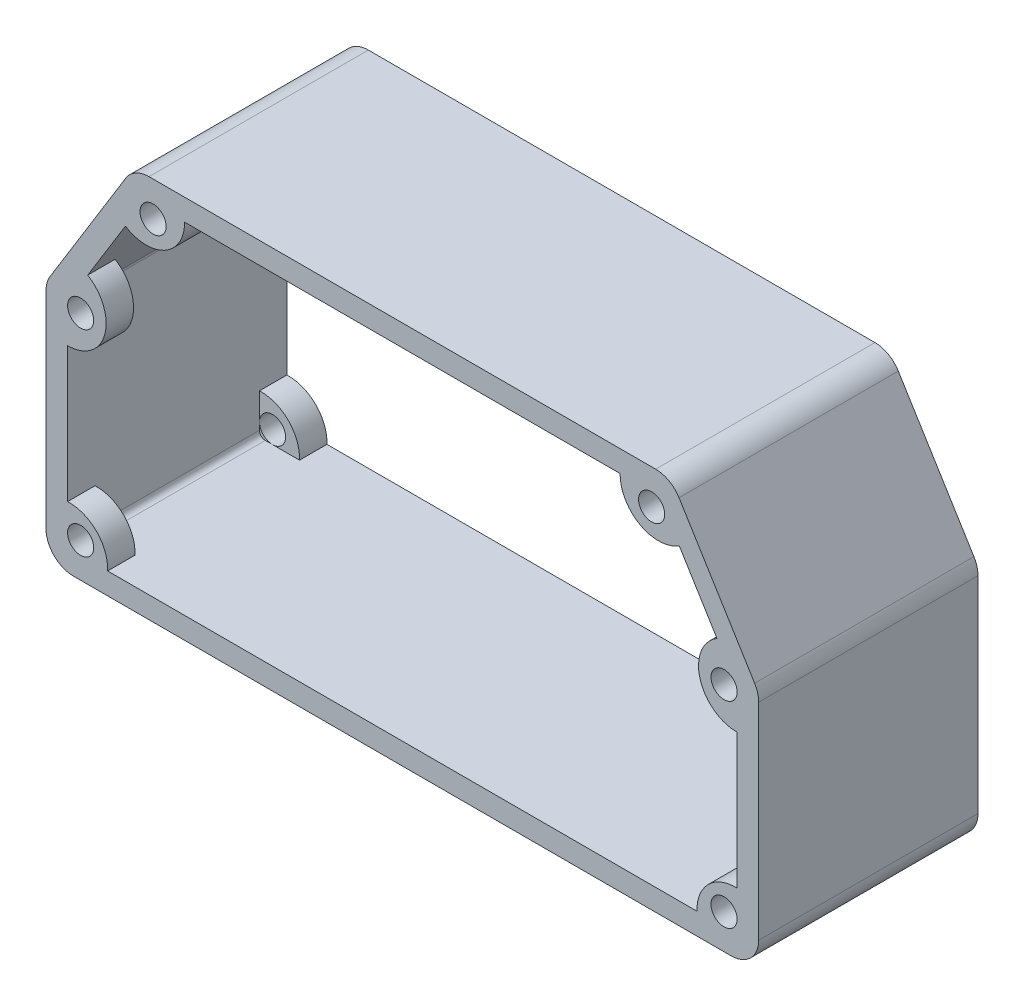
from build123d import *

# Parameters (mm, degrees)
SKETCH1_W               = 165.1
SKETCH1_H               = 88.9
BOSS_EXTRUDE1_DEPTH     = 50.8
CUT_EXTRUDE1_DEPTH      = 107.634633211
FILLET1_R               = 6.35
SHELL1_T                = -5
CUT_EXTRUDE2_DEPTH      = 105.345316138
BOSS_EXTRUDE2_DEPTH     = 6.35
CUT_EXTRUDE3_DEPTH      = 107.634633211
CUT_EXTRUDE3_DEPTH_BACK = 107.634633211
SKETCH6_R               = 3.025013
CUT_EXTRUDE4_DEPTH      = 1.27


with BuildPart() as part:
    # Sketch1 → Boss-Extrude1 (new body)
    with BuildSketch(Plane.XY):
        Rectangle(SKETCH1_W, SKETCH1_H)
    extrude(amount=BOSS_EXTRUDE1_DEPTH)

    # Sketch2 → Cut-Extrude1 (cut, through all)
    with BuildSketch(Plane(origin=(0, 0, 0), x_dir=(-1, 0, 0), z_dir=(0, 0, -1))):
        Polygon((-82.55, 44.45), (-82.55, 11.43), (-62.23, 44.45), align=None)
        Polygon((82.55, 44.45), (62.23, 44.45), (82.55, 11.43), align=None)
    extrude(amount=-CUT_EXTRUDE1_DEPTH, mode=Mode.SUBTRACT)

    # Fillet1
    fillet1_edges = [part.edges().sort_by_distance(p)[0] for p in [
        (82.55, -44.45, 25.4),
        (82.55, 11.43, 25.4),
        (62.23, 44.45, 25.4),
        (-62.23, 44.45, 25.4),
        (-82.55, 11.43, 25.4),
        (-82.55, -44.45, 25.4),
    ]]
    fillet(fillet1_edges, radius=FILLET1_R)

    # Shell1
    shell1_openings = [part.faces().sort_by_distance(p)[0] for p in [
        (0, -1.56423777, 0),
    ]]
    offset(amount=SHELL1_T, openings=shell1_openings, kind=Kind.INTERSECTION)

    # Sketch4 → Cut-Extrude2 (cut, through all)
    with BuildSketch(Plane(origin=(0, 0, 45.8), x_dir=(-1, 0, 0), z_dir=(0, 0, -1))):
        with BuildLine():
            Line((-59.831389245, 38.807531525), (-77.349738728, 10.340213616))
            ThreePointArc((-77.349738728, 10.340213616), (-77.498970223, 10.000345469), (-77.55, 9.632682092))
            Line((-77.55, 9.632682092), (-77.55, -38.1))
            ThreePointArc((-77.55, -38.1), (-77.154594155, -39.054594155), (-76.2, -39.45))
            Line((-76.2, -39.45), (76.2, -39.45))
            ThreePointArc((76.2, -39.45), (77.154594155, -39.054594155), (77.55, -38.1))
            Line((77.55, -38.1), (77.55, 9.632682092))
            ThreePointArc((77.55, 9.632682092), (77.498970223, 10.000345469), (77.349738728, 10.340213616))
            Line((77.349738728, 10.340213616), (59.831389245, 38.807531525))
            ThreePointArc((59.831389245, 38.807531525), (59.340183904, 39.278487921), (58.681650518, 39.45))
            Line((58.681650518, 39.45), (-58.681650518, 39.45))
            ThreePointArc((-58.681650518, 39.45), (-59.340183904, 39.278487921), (-59.831389245, 38.807531525))
        make_face()
    extrude(amount=-CUT_EXTRUDE2_DEPTH, mode=Mode.SUBTRACT)

    # Sketch5 → Boss-Extrude2 (add)
    with BuildSketch(Plane.XY.offset(50.8)):
        with BuildLine():
            Line((-76.2, -39.45), (-68.273391859, -39.45))
            ThreePointArc((-68.273391859, -39.45), (-70.86841487, -32.76841487), (-77.55, -30.173391859))
            Line((-77.55, -30.173391859), (-77.55, -38.1))
            ThreePointArc((-77.55, -38.1), (-77.154594155, -39.054594155), (-76.2, -39.45))
        make_face()
        with BuildLine():
            ThreePointArc((77.55, -30.173391859), (70.86841487, -32.76841487), (68.273391859, -39.45))
            Line((68.273391859, -39.45), (76.2, -39.45))
            ThreePointArc((76.2, -39.45), (77.154594155, -39.054594155), (77.55, -38.1))
            Line((77.55, -38.1), (77.55, -30.173391859))
        make_face()
        with BuildLine():
            Line((-77.55, 9.632682092), (-77.55, 1.110491929))
            ThreePointArc((-77.55, 1.110491929), (-68.945010753, 7.579214044), (-72.883280802, 17.598207745))
            Line((-72.883280802, 17.598207745), (-77.349738728, 10.340213616))
            ThreePointArc((-77.349738728, 10.340213616), (-77.498970223, 10.000345469), (-77.55, 9.632682092))
        make_face()
        with BuildLine():
            ThreePointArc((72.883280802, 17.598207745), (68.945010753, 7.579214044), (77.55, 1.110491929))
            Line((77.55, 1.110491929), (77.55, 9.632682092))
            ThreePointArc((77.55, 9.632682092), (77.498970223, 10.000345469), (77.349738728, 10.340213616))
            Line((77.349738728, 10.340213616), (72.883280802, 17.598207745))
        make_face()
        with BuildLine():
            Line((-59.831389245, 38.807531525), (-64.144612525, 31.798543695))
            ThreePointArc((-64.144612525, 31.798543695), (-55.003619605, 31.517926725), (-50.451838523, 39.45))
            Line((-50.451838523, 39.45), (-58.681650518, 39.45))
            ThreePointArc((-58.681650518, 39.45), (-59.340183904, 39.278487921), (-59.831389245, 38.807531525))
        make_face()
        with BuildLine():
            ThreePointArc((50.451838523, 39.45), (55.003619605, 31.517926725), (64.144612525, 31.798543695))
            Line((64.144612525, 31.798543695), (59.831389245, 38.807531525))
            ThreePointArc((59.831389245, 38.807531525), (59.340183904, 39.278487921), (58.681650518, 39.45))
            Line((58.681650518, 39.45), (50.451838523, 39.45))
        make_face()
    boss_extrude2 = extrude(amount=-BOSS_EXTRUDE2_DEPTH)

    # Mirror1: Boss-Extrude2 across plane
    add(boss_extrude2.mirror(Plane.XY.offset(25.4)))

    # Sketch6 → Cut-Extrude3 (cut, two sides: drawn at the far end of the back side and taken through both)
    with BuildSketch(Plane(origin=(0, 0, 0), x_dir=(-1, 0, 0), z_dir=(0, 0, -1)).offset(-CUT_EXTRUDE3_DEPTH_BACK)):
        with Locations((74.524987, -36.424987)):
            Circle(SKETCH6_R)
        with Locations((74.524987, 9.158582743)):
            Circle(SKETCH6_R)
        with Locations((57.745661304, 36.424987)):
            Circle(SKETCH6_R)
        with Locations((-57.745661304, 36.424987)):
            Circle(SKETCH6_R)
        with Locations((-74.524987, 9.158582743)):
            Circle(SKETCH6_R)
        with Locations((-74.524987, -36.424987)):
            Circle(SKETCH6_R)
    extrude(amount=CUT_EXTRUDE3_DEPTH + CUT_EXTRUDE3_DEPTH_BACK, mode=Mode.SUBTRACT)

    # Sketch7 → Cut-Extrude4 (cut)
    with BuildSketch(Plane.XY):
        with BuildLine():
            Line((-76.2, -43.18), (76.2, -43.18))
            ThreePointArc((76.2, -43.18), (79.792102448, -41.692102448), (81.28, -38.1))
            Line((81.28, -38.1), (81.28, 9.632682092))
            ThreePointArc((81.28, 9.632682092), (81.08797684, 11.016185763), (80.526424249, 12.295097014))
            Line((80.526424249, 12.295097014), (63.008074767, 40.762414922))
            ThreePointArc((63.008074767, 40.762414922), (61.15968726, 42.534606398), (58.681650518, 43.18))
            Line((58.681650518, 43.18), (-58.681650518, 43.18))
            ThreePointArc((-58.681650518, 43.18), (-61.15968726, 42.534606398), (-63.008074767, 40.762414922))
            Line((-63.008074767, 40.762414922), (-80.526424249, 12.295097014))
            ThreePointArc((-80.526424249, 12.295097014), (-81.08797684, 11.016185763), (-81.28, 9.632682092))
            Line((-81.28, 9.632682092), (-81.28, -38.1))
            ThreePointArc((-81.28, -38.1), (-79.792102448, -41.692102448), (-76.2, -43.18))
        make_face()
        with BuildLine():
            Line((-76.2, -40.64), (76.2, -40.64))
            ThreePointArc((76.2, -40.64), (77.996051224, -39.896051224), (78.74, -38.1))
            Line((78.74, -38.1), (78.74, 9.632682092))
            ThreePointArc((78.74, 9.632682092), (78.64398842, 10.324433927), (78.363212124, 10.963889553))
            Line((78.363212124, 10.963889553), (60.844862642, 39.431207461))
            ThreePointArc((60.844862642, 39.431207461), (59.920668889, 40.317303199), (58.681650518, 40.64))
            Line((58.681650518, 40.64), (-58.681650518, 40.64))
            ThreePointArc((-58.681650518, 40.64), (-59.920668889, 40.317303199), (-60.844862642, 39.431207461))
            Line((-60.844862642, 39.431207461), (-78.363212124, 10.963889553))
            ThreePointArc((-78.363212124, 10.963889553), (-78.64398842, 10.324433927), (-78.74, 9.632682092))
            Line((-78.74, 9.632682092), (-78.74, -38.1))
            ThreePointArc((-78.74, -38.1), (-77.996051224, -39.896051224), (-76.2, -40.64))
        make_face(mode=Mode.SUBTRACT)
    extrude(amount=CUT_EXTRUDE4_DEPTH, mode=Mode.SUBTRACT)


solid = part.part
